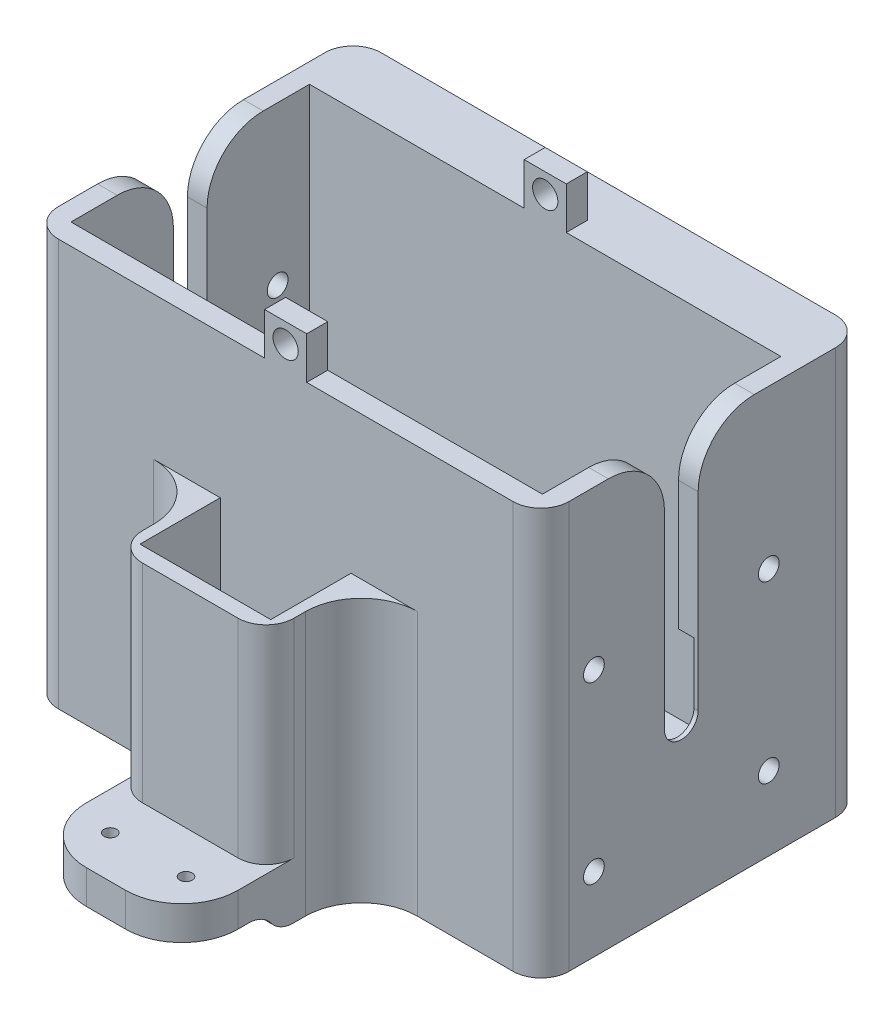
from build123d import *

# Parameters (mm, degrees)
BOSS_EXTRU_1_DEPTH       = 84
ESQUISSE6_W              = 27
ESQUISSE6_H              = 47
BOSS_EXTRU_3_DEPTH       = 17
ESQUISSE7_W              = 23.3
ESQUISSE7_H              = 14.3
ENL_V_MAT_EXTRU_4_DEPTH  = 43.3
ESQUISSE8_R              = 1.85
BOSS_EXTRU_4_DEPTH       = 3.5
ESQUISSE12_R             = 11.25
ENL_V_MAT_EXTRU_7_DEPTH  = 2.75
ESQUISSE13_W             = 27
ESQUISSE13_H             = 10
BOSS_EXTRU_5_DEPTH       = 15
ESQUISSE15_W             = 27
ESQUISSE15_H             = 15
ENL_V_MAT_EXTRU_9_DEPTH  = 4
ESQUISSE14_R             = 1.11
ENL_V_MAT_EXTRU_8_DEPTH  = 15
CONG_6_R                 = 5
CONG_7_R                 = 5
CONG_1_R                 = 10
CONG_2_R                 = 10
CONG_3_R                 = 10
CONG_4_R                 = 5
CONG_8_R                 = 5
BOSS_EXTRU_6_DEPTH       = 7.5
ESQUISSE17_R             = 2.25
ENL_V_MAT_EXTRU_10_DEPTH = 110.832109883
ESQUISSE20_W             = 91
ESQUISSE20_H             = 72.5
BOSS_EXTRU_7_DEPTH       = 7.5
ESQUISSE21_R             = 1.7
ESQUISSE21_R_2           = 1.699999999
ENL_V_MAT_EXTRU_11_DEPTH = 5
CONG_9_R                 = 5


with BuildPart() as part:
    # Esquisse1 → Boss.-Extru.1 (new body)
    with BuildSketch(Plane(origin=(0, 0, 0), x_dir=(0, 0, -1), z_dir=(1, 0, 0))):
        Polygon((-15.842295968, 13.667406166), (-15.842295968, -28.832593834), (26.657704032, -28.832593834), (26.657704032, 13.667406166), (26.657704032, 36.167406166), (30.407704032, 36.167406166), (30.407704032, 13.667406166), (30.407704032, -36.332593834), (-19.592295968, -36.332593834), (-19.592295968, 13.667406166), (-19.592295968, 36.167406166), (-15.842295968, 36.167406166), align=None)
    extrude(amount=BOSS_EXTRU_1_DEPTH)

    # Esquisse6 → Boss.-Extru.3 (add)
    with BuildSketch(Plane.XY.offset(19.592295968)):
        with Locations((42, -12.832593834)):
            Rectangle(ESQUISSE6_W, ESQUISSE6_H)
    extrude(amount=BOSS_EXTRU_3_DEPTH)

    # Esquisse7 → Enlèv. mat.-Extru.4 (cut)
    with BuildSketch(Plane(origin=(0, 10.667406166, 0), x_dir=(1, 0, 0), z_dir=(0, 1, 0))):
        with Locations((42, -26.742295968)):
            Rectangle(ESQUISSE7_W, ESQUISSE7_H)
    extrude(amount=-ENL_V_MAT_EXTRU_4_DEPTH, mode=Mode.SUBTRACT)

    # Esquisse8 → Boss.-Extru.4 (add)
    with BuildSketch(Plane(origin=(84, 0, 0), x_dir=(0, 0, -1), z_dir=(1, 0, 0))):
        with BuildLine():
            Line((-19.592295968, -36.332593834), (30.407704032, -36.332593834))
            Line((30.407704032, -36.332593834), (30.407704032, 13.667406166))
            Line((30.407704032, 13.667406166), (30.407704032, 36.167406166))
            Line((30.407704032, 36.167406166), (8.407704032, 36.167406166))
            Line((8.407704032, 36.167406166), (8.407704032, 13.667406166))
            Line((8.407704032, 13.667406166), (8.407704032, -7.582593834))
            ThreePointArc((8.407704032, -7.582593834), (5.407704032, -10.582593834), (2.407704032, -7.582593834))
            Line((2.407704032, -7.582593834), (2.407704032, 13.667406166))
            Line((2.407704032, 13.667406166), (2.407704032, 36.167406166))
            Line((2.407704032, 36.167406166), (-19.592295968, 36.167406166))
            Line((-19.592295968, 36.167406166), (-19.592295968, 13.667406166))
            Line((-19.592295968, 13.667406166), (-19.592295968, -36.332593834))
        make_face()
        with Locations((-10.167295968, 7.992406166)):
            Circle(ESQUISSE8_R, mode=Mode.SUBTRACT)
        with Locations((20.982704032, 7.992406166)):
            Circle(ESQUISSE8_R, mode=Mode.SUBTRACT)
        with Locations((20.982704032, -23.157593834)):
            Circle(ESQUISSE8_R, mode=Mode.SUBTRACT)
        with Locations((-10.167295968, -23.157593834)):
            Circle(ESQUISSE8_R, mode=Mode.SUBTRACT)
    boss_extru_4 = extrude(amount=BOSS_EXTRU_4_DEPTH)

    # Esquisse12 → Enlèv. mat.-Extru.7 (cut)
    with BuildSketch(Plane.ZY.offset(-84)):
        with Locations((-5.407704032, -7.582593834)):
            Circle(ESQUISSE12_R)
    enl_v_mat_extru_7 = extrude(amount=-ENL_V_MAT_EXTRU_7_DEPTH, mode=Mode.SUBTRACT)

    # Symétrie1: Boss.-Extru.4, Enlèv. mat.-Extru.7 across plane
    add(boss_extru_4.mirror(Plane.ZY.offset(-42)))
    add(enl_v_mat_extru_7.mirror(Plane.ZY.offset(-42)), mode=Mode.SUBTRACT)

    # Esquisse13 → Boss.-Extru.5 (add)
    with BuildSketch(Plane.XY.offset(36.592295968)):
        with Locations((42, -31.332593834)):
            Rectangle(ESQUISSE13_W, ESQUISSE13_H)
    extrude(amount=BOSS_EXTRU_5_DEPTH)

    # Esquisse15 → Enlèv. mat.-Extru.9 (cut)
    with BuildSketch(Plane.XZ.offset(36.332593834)):
        with Locations((42, 44.092295968)):
            Rectangle(ESQUISSE15_W, ESQUISSE15_H)
    extrude(amount=-ENL_V_MAT_EXTRU_9_DEPTH, mode=Mode.SUBTRACT)

    # Esquisse14 → Enlèv. mat.-Extru.8 (cut)
    with BuildSketch(Plane.XZ.offset(36.332593834)):
        with Locations(Location((35.25, 44.092295968, 0), (0, 0, 270))):
            Circle(ESQUISSE14_R)
        with Locations(Location((48.75, 44.092295968, 0), (0, 0, 270))):
            Circle(ESQUISSE14_R)
    extrude(amount=-ENL_V_MAT_EXTRU_8_DEPTH, mode=Mode.SUBTRACT)

    # Congé6
    # the kernel refuses this fillet: 5 mm, written as the material it takes off along each edge
    with BuildSketch(Plane(origin=(67.747448714, -36.332593834, 36.592295968), x_dir=(0, 0, -1), z_dir=(-1, 0, 0))) as cong_6_piece_1:
        with BuildLine():
            CenterArc((4.898979486, -5), CONG_6_R, 90, 78.463040967)
            Line((0, -4), (-0.09797959, -3.98))
            ThreePointArc((-0.09797959, -3.98), (-0.1, -2), (-0.1, 0))
            Line((-0.1, 0), (0, 0.1))
            Line((0, 0.1), (4.898979486, 0.1))
            Line((4.898979486, 0.1), (4.898979486, 0))
        make_face()
    extrude(amount=51.494897428, mode=Mode.SUBTRACT)

    # Congé7
    cong_7_edges = [part.edges().sort_by_distance(p)[0] for p in [
        (42, -32.332593834, 36.592295968),
    ]]
    fillet(cong_7_edges, radius=CONG_7_R)

    # Congé1
    cong_1_edges = [part.edges().sort_by_distance(p)[0] for p in [
        (28.5, -29.332593834, 51.592295968),
        (55.5, -29.332593834, 51.592295968),
    ]]
    fillet(cong_1_edges, radius=CONG_1_R)

    # Congé2
    cong_2_edges = [part.edges().sort_by_distance(p)[0] for p in [
        (-1.75, 36.167406166, -8.407704032),
        (-1.75, 36.167406166, -2.407704032),
        (85.75, 36.167406166, -2.407704032),
        (85.75, 36.167406166, -8.407704032),
    ]]
    fillet(cong_2_edges, radius=CONG_2_R)

    # Congé3
    cong_3_edges = [part.edges().sort_by_distance(p)[0] for p in [
        (28.5, -12.832593834, 19.592295968),
        (55.5, -12.832593834, 19.592295968),
    ]]
    fillet(cong_3_edges, radius=CONG_3_R)

    # Congé4
    cong_4_edges = [part.edges().sort_by_distance(p)[0] for p in [
        (-3.5, -0.082593834, 19.592295968),
        (87.5, -0.082593834, 19.592295968),
    ]]
    fillet(cong_4_edges, radius=CONG_4_R)

    # Congé8
    cong_8_edges = [part.edges().sort_by_distance(p)[0] for p in [
        (55.5, -7.832593834, 36.592295968),
        (28.5, -7.832593834, 36.592295968),
    ]]
    fillet(cong_8_edges, radius=CONG_8_R)

    # Esquisse16 → Boss.-Extru.6 (add)
    with BuildSketch(Plane(origin=(0, 36.167406166, 0), x_dir=(1, 0, 0), z_dir=(0, 1, 0))):
        Polygon((39.5, -15.842295968), (44.5, -15.842295968), (45.75, -15.842295968), (45.75, -19.592295968), (44.5, -19.592295968), (39.5, -19.592295968), (38.25, -19.592295968), (38.25, -15.842295968), align=None)
        Polygon((39.5, 26.657704032), (38.25, 26.657704032), (38.25, 30.407704032), (39.5, 30.407704032), (44.5, 30.407704032), (45.75, 30.407704032), (45.75, 26.657704032), (44.5, 26.657704032), align=None)
    extrude(amount=BOSS_EXTRU_6_DEPTH)

    # Esquisse17 → Enlèv. mat.-Extru.10 (cut, through all)
    with BuildSketch(Plane.XY.offset(19.592295968)):
        with Locations((42, 40.167406166)):
            Circle(ESQUISSE17_R)
    extrude(amount=-ENL_V_MAT_EXTRU_10_DEPTH, mode=Mode.SUBTRACT)

    # Esquisse20 → Boss.-Extru.7 (add)
    with BuildSketch(Plane(origin=(0, 0, -30.407704032), x_dir=(-1, 0, 0), z_dir=(0, 0, -1))):
        with Locations((-42, -0.082593834)):
            Rectangle(ESQUISSE20_W, ESQUISSE20_H)
    extrude(amount=BOSS_EXTRU_7_DEPTH)

    # Esquisse21 → Enlèv. mat.-Extru.11 (cut)
    with BuildSketch(Plane(origin=(0, 0, -37.907704032), x_dir=(-1, 0, 0), z_dir=(0, 0, -1))):
        with Locations((-75.947901314, -27.418139831)):
            Circle(ESQUISSE21_R)
        with Locations((-9.667901314, -27.162593831)):
            Circle(ESQUISSE21_R_2)
        with Locations((-75.947901314, 27.257406166)):
            Circle(ESQUISSE21_R)
    extrude(amount=-ENL_V_MAT_EXTRU_11_DEPTH, mode=Mode.SUBTRACT)

    # Congé9
    cong_9_edges = [part.edges().sort_by_distance(p)[0] for p in [
        (87.5, -0.082593834, -37.907704032),
        (-3.5, -0.082593834, -37.907704032),
    ]]
    fillet(cong_9_edges, radius=CONG_9_R)


solid = part.part
